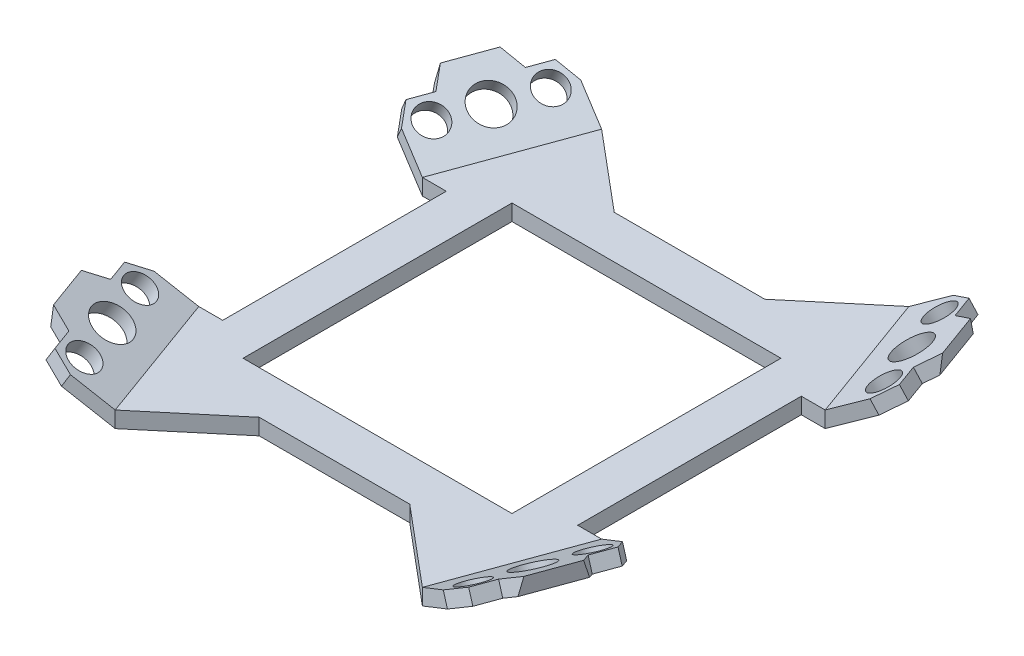
from build123d import *

# Parameters (mm, degrees)
SKETCH11_W                = 100
SKETCH11_H                = 100
BOSS_EXTRUDE6_DEPTH       = 6
BOSS_EXTRUDE7_DEPTH       = 52
SKETCH13_R                = 5.5
SKETCH13_R_2              = 7
CUT_EXTRUDE1_DEPTH        = 144.917344099
MIRROR4_COPY_1_DEPTH      = 52
MIRROR4_COPY_2_SKETCH_R   = 5.5
MIRROR4_COPY_2_SKETCH_R_2 = 7
MIRROR4_COPY_2_DEPTH      = 144.917344099


with BuildPart() as part:
    # Sketch11 → Boss-Extrude6 (new body)
    with BuildSketch(Plane(origin=(0, 0, 0), x_dir=(1, 0, 0), z_dir=(0, 1, 0))):
        Polygon((-27.990542798, -66), (27.990542798, -66), (57.107476274, -90.43200814), (74.892523726, -41.56799186), (66, -41.56799186), (66, 41.56799186), (74.892523726, 41.56799186), (57.107476274, 90.43200814), (27.990542798, 66), (-27.990542798, 66), (-57.107476274, 90.43200814), (-74.892523726, 41.56799186), (-66, 41.56799186), (-66, 17.135983719), (-66, -41.56799186), (-74.892523726, -41.56799186), (-57.107476274, -90.43200814), align=None)
        Rectangle(SKETCH11_W, SKETCH11_H, mode=Mode.SUBTRACT)
    extrude(amount=BOSS_EXTRUDE6_DEPTH)

    # Sketch12 → Boss-Extrude7 (add)
    with BuildSketch(Plane(origin=(4.598934016, 0, -12.635467363), x_dir=(0, -1, 0), z_dir=(0.3420201433256626, 0, -0.9396926207859108))):
        Polygon((-6, 84.593042431), (-21, 110.573804545), (-15, 110.573804545), (0, 84.593042431), align=None)
    boss_extrude7 = extrude(amount=BOSS_EXTRUDE7_DEPTH)

    # Sketch13 → Cut-Extrude1 (cut, through all)
    with BuildSketch(Plane(origin=(-17.431471392, -32.129861864, -6.344536726), x_dir=(0.8827482339886774, -0.46094551652187815, -0.0910208008548064), z_dir=(0.46984631039295327, 0.86602540378444, 0.17101007166283055))):
        with Locations((-75.558670233, 55.756626288)):
            Circle(SKETCH13_R)
        with Locations((-68.848049182, 71.72377898)):
            Circle(SKETCH13_R_2)
        with Locations((-62.13742813, 87.690931672)):
            Circle(SKETCH13_R)
        Polygon((-86.03182363, 69.551707225), (-80.807284881, 62.669659952), (-84.170147539, 54.668114175), (-78.921729744, 47.754612121), (-92.75009524, 53.566350907), align=None)
        Polygon((-58.774368619, 95.692945839), (-67.38534186, 94.604497442), (-70.748204517, 86.602951665), (-79.321005725, 85.519328308), (-72.602734115, 101.504684625), align=None)
    cut_extrude1 = extrude(amount=-CUT_EXTRUDE1_DEPTH, mode=Mode.SUBTRACT)

    # Mirror3: Boss-Extrude7, Cut-Extrude1 across plane
    add(boss_extrude7.mirror(Plane(origin=(0, 0, 0), x_dir=(0, 0, 1), z_dir=(1, 0, 0))))
    add(cut_extrude1.mirror(Plane(origin=(0, 0, 0), x_dir=(0, 0, 1), z_dir=(1, 0, 0))), mode=Mode.SUBTRACT)

    # Mirror4: Boss-Extrude7, Cut-Extrude1 across plane
    add(boss_extrude7.mirror(Plane.XY))
    add(cut_extrude1.mirror(Plane.XY), mode=Mode.SUBTRACT)

    # Mirror4 copy 1 sketch → Mirror4 copy 1 (add)
    with BuildSketch(Plane(origin=(-4.598934016, 0, 12.635467363), x_dir=(0, -1, 0), z_dir=(-0.3420201433256626, 0, 0.9396926207859108))):
        Polygon((-6, 84.593042431), (-21, 110.573804545), (-15, 110.573804545), (0, 84.593042431), align=None)
    extrude(amount=MIRROR4_COPY_1_DEPTH)

    # Mirror4 copy 2 sketch → Mirror4 copy 2 (cut, through all)
    with BuildSketch(Plane(origin=(17.431471392, -32.129861864, 6.344536726), x_dir=(-0.8827482339886774, -0.46094551652187815, 0.0910208008548064), z_dir=(-0.46984631039295327, 0.86602540378444, -0.17101007166283055))):
        with Locations((-75.558670233, 55.756626288)):
            Circle(MIRROR4_COPY_2_SKETCH_R)
        with Locations((-68.848049182, 71.72377898)):
            Circle(MIRROR4_COPY_2_SKETCH_R_2)
        with Locations((-62.13742813, 87.690931672)):
            Circle(MIRROR4_COPY_2_SKETCH_R)
        Polygon((-86.03182363, 69.551707225), (-80.807284881, 62.669659952), (-84.170147539, 54.668114175), (-78.921729744, 47.754612121), (-92.75009524, 53.566350907), align=None)
        Polygon((-58.774368619, 95.692945839), (-67.38534186, 94.604497442), (-70.748204517, 86.602951665), (-79.321005725, 85.519328308), (-72.602734115, 101.504684625), align=None)
    extrude(amount=-MIRROR4_COPY_2_DEPTH, mode=Mode.SUBTRACT)


solid = part.part
